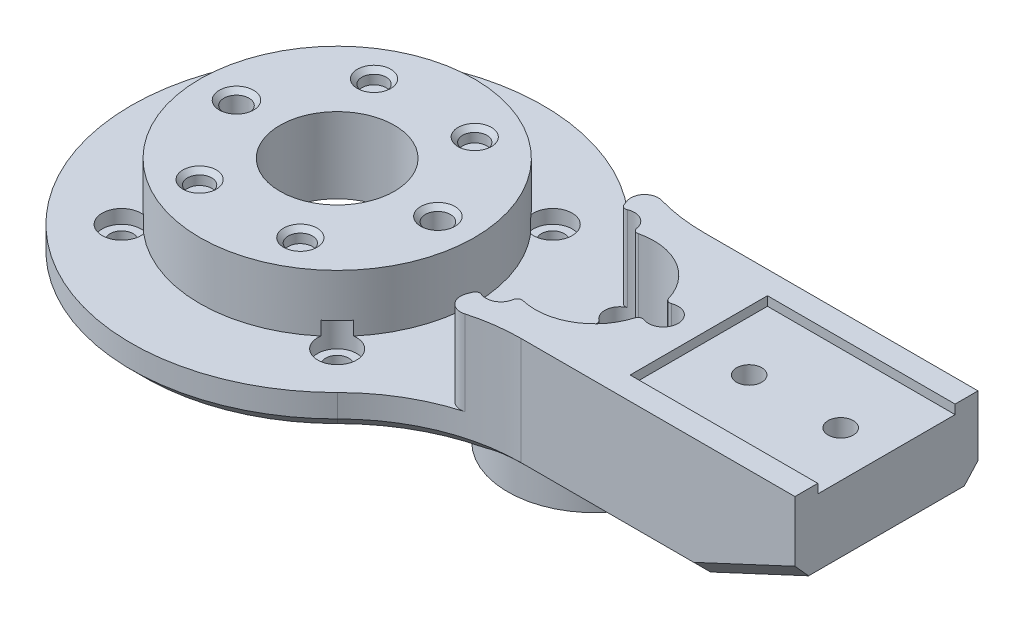
from build123d import *

# Parameters (mm, degrees)
SKETCH1_R           = 30
BOSS_EXTRUDE1_DEPTH = 12.5
SKETCH3_R           = 45.00000000000001
BOSS_EXTRUDE3_DEPTH = 8
CUT_EXTRUDE1_DEPTH  = 2
SKETCH5_R           = 19.5
CUT_EXTRUDE2_DEPTH  = 2
SKETCH6_R           = 2.4999999999999982
CUT_EXTRUDE3_DEPTH  = 67.27405223765936
SKETCH8_R           = 12.5
CUT_EXTRUDE4_DEPTH  = 67.8599282081577
SKETCH12_R          = 4.249999999999998
CUT_EXTRUDE7_DEPTH  = 3
SKETCH9_R           = 2.649999999999998
SKETCH9_R_2         = 2.65
CUT_EXTRUDE11_DEPTH = 3
BOSS_EXTRUDE4_START = -8
BOSS_EXTRUDE4_DEPTH = 8
BOSS_EXTRUDE5_DEPTH = 18.5
CHAMFER1_SIZE       = 10
CHAMFER1_SIZE2      = 21.445069205095713
FILLET1_R           = 40
SKETCH21_R          = 13.000000000000023
CUT_EXTRUDE12_DEPTH = 65.99999999999999
SKETCH22_R          = 19.00000000000001
BOSS_EXTRUDE6_DEPTH = 5
CUT_EXTRUDE13_START = 22.000000000000007
SKETCH24_R          = 13.000000000000023
CUT_EXTRUDE13_DEPTH = 22.000000000000007
CUT_EXTRUDE14_DEPTH = 41
SKETCH26_R          = 2.750000000000008
CUT_EXTRUDE15_DEPTH = 131.87111980876452
SKETCH27_R          = 4.600000000000013
SKETCH27_R_2        = 4.599999999999999
CUT_EXTRUDE16_DEPTH = 12
CHAMFER3_SIZE       = 3
SKETCH43_R          = 1.749999999999997
SKETCH43_R_2        = 1.7500000000000038
SKETCH43_R_3        = 1.7500000000000033
CUT_EXTRUDE22_DEPTH = 42.00000000000001
SKETCH44_R          = 3.0000000000000013
CUT_EXTRUDE23_DEPTH = 7.99999999999998
SKETCH17_R          = 2.7499999999999982
CUT_EXTRUDE25_DEPTH = 131.67230004863384
CUT_EXTRUDE26_DEPTH = 11.999999999999996
CUT_EXTRUDE27_START = 3
SKETCH48_R          = 4.249999999999998
CUT_EXTRUDE27_DEPTH = 3
FILLET2_R           = 3
SKETCH49_R          = 3.250000000000001
SKETCH49_R_2        = 3.250000000000007
CUT_EXTRUDE28_DEPTH = 23.000000000000007
FILLET3_R           = 1
FILLET4_R           = 1
CHAMFER4_SIZE       = 1
CHAMFER5_SIZE       = 1
CHAMFER6_SIZE       = 1


with BuildPart() as part:
    # Sketch1 → Boss-Extrude1 (new body)
    with BuildSketch(Plane(origin=(0, 0, 0), x_dir=(1, 0, 0), z_dir=(0, 1, 0))):
        with Locations(Location((0, 0, 0), (0, 0, 270))):
            Circle(SKETCH1_R)
    extrude(amount=BOSS_EXTRUDE1_DEPTH)

    # Sketch3 → Boss-Extrude3 (add)
    with BuildSketch(Plane.XZ):
        with Locations(Location((0, 0, 0), (0, 0, 270))):
            Circle(SKETCH3_R)
    extrude(amount=BOSS_EXTRUDE3_DEPTH)

    # Sketch4 → Cut-Extrude1 (cut)
    with BuildSketch(Plane.XZ.offset(8)):
        with BuildLine():
            Line((-23.499999999999993, -28.5), (23.5, -28.5))
            ThreePointArc((23.5, -28.5), (27.035533905932738, -27.035533905932738), (28.499999999999996, -23.5))
            Line((28.499999999999996, -23.5), (28.499999999999996, 23.5))
            ThreePointArc((28.499999999999996, 23.5), (27.035533905932738, 27.03553390593273), (23.500000000000004, 28.499999999999996))
            Line((23.500000000000004, 28.499999999999996), (-23.499999999999996, 28.499999999999996))
            ThreePointArc((-23.499999999999996, 28.499999999999996), (-27.03553390593273, 27.035533905932734), (-28.499999999999996, 23.5))
            Line((-28.499999999999996, 23.5), (-28.49999999999999, -23.5))
            ThreePointArc((-28.49999999999999, -23.5), (-27.03553390593273, -27.035533905932734), (-23.499999999999993, -28.5))
        make_face()
    extrude(amount=-CUT_EXTRUDE1_DEPTH, mode=Mode.SUBTRACT)

    # Sketch5 → Cut-Extrude2 (cut)
    with BuildSketch(Plane.XZ.offset(6)):
        with Locations(Location((0, 0, 0), (0, 0, 270))):
            Circle(SKETCH5_R)
    extrude(amount=-CUT_EXTRUDE2_DEPTH, mode=Mode.SUBTRACT)

    # Sketch6 → Cut-Extrude3 (cut, through all)
    with BuildSketch(Plane.XZ.offset(6)):
        with Locations(Location((-23.550000000000008, 23.549999999999994, 0), (0, 0, 270))):
            Circle(SKETCH6_R)
        with Locations(Location((23.549999999999994, 23.549999999999994, 0), (0, 0, 270))):
            Circle(SKETCH6_R)
        with Locations(Location((23.549999999999994, -23.550000000000008, 0), (0, 0, 270))):
            Circle(SKETCH6_R)
        with Locations(Location((-23.550000000000008, -23.550000000000008, 0), (0, 0, 270))):
            Circle(SKETCH6_R)
    extrude(amount=-CUT_EXTRUDE3_DEPTH, mode=Mode.SUBTRACT)

    # Sketch8 → Cut-Extrude4 (cut, through all)
    with BuildSketch(Plane(origin=(0, 12.5, 0), x_dir=(1, 0, 0), z_dir=(0, 1, 0))):
        with Locations(Location((0, 0, 0), (0, 0, 270))):
            Circle(SKETCH8_R)
    extrude(amount=-CUT_EXTRUDE4_DEPTH, mode=Mode.SUBTRACT)

    # Sketch12 → Cut-Extrude7 (cut)
    with BuildSketch(Plane(origin=(0, 0, 0), x_dir=(1, 0, 0), z_dir=(0, 1, 0))):
        with Locations(Location((-23.550000000000008, 23.550000000000008, 0), (0, 0, 270))):
            Circle(SKETCH12_R)
        with Locations(Location((23.549999999999994, 23.550000000000008, 0), (0, 0, 270))):
            Circle(SKETCH12_R)
        with Locations(Location((23.549999999999994, -23.549999999999994, 0), (0, 0, 270))):
            Circle(SKETCH12_R)
        with Locations(Location((-23.550000000000008, -23.549999999999994, 0), (0, 0, 270))):
            Circle(SKETCH12_R)
    extrude(amount=-CUT_EXTRUDE7_DEPTH, mode=Mode.SUBTRACT)

    # Sketch9 → Cut-Extrude11 (cut)
    with BuildSketch(Plane(origin=(0, 12.5, 0), x_dir=(1, 0, 0), z_dir=(0, 1, 0))):
        with Locations(Location((11.000000000000009, -19.052558883257646, 0), (0, 0, 270))):
            Circle(SKETCH9_R)
        with Locations(Location((10.999999999999996, 19.052558883257657, 0), (0, 0, 270))):
            Circle(SKETCH9_R_2)
        with Locations(Location((-11.000000000000009, 19.05255888325765, 0), (0, 0, 270))):
            Circle(SKETCH9_R)
        with Locations(Location((-10.999999999999984, -19.05255888325766, 0), (0, 0, 270))):
            Circle(SKETCH9_R)
    extrude(amount=-CUT_EXTRUDE11_DEPTH, mode=Mode.SUBTRACT)

    # Sketch19 → Boss-Extrude4 (add)
    with BuildSketch(Plane.XZ.offset(8).offset(BOSS_EXTRUDE4_START)):
        with BuildLine():
            Line((40.31128874149275, -20), (120, -20))
            Line((120, -20), (120, 20))
            Line((120, 20), (40.31128874149275, 20))
            ThreePointArc((40.31128874149275, 20), (45.00000000000001, 0), (40.31128874149275, -20))
        make_face()
    extrude(amount=BOSS_EXTRUDE4_DEPTH)

    # Sketch20 → Boss-Extrude5 (add)
    with BuildSketch(Plane(origin=(0, 0, 0), x_dir=(1, 0, 0), z_dir=(0, 1, 0))):
        with BuildLine():
            Line((44.73253849269008, -20), (120, -20))
            Line((120, -20), (120, 20))
            Line((120, 20), (44.73253849269008, 20))
            ThreePointArc((44.73253849269008, 20), (49, 0), (44.73253849269008, -20))
        make_face()
    extrude(amount=BOSS_EXTRUDE5_DEPTH)

    # Chamfer1
    chamfer1_edges = [part.edges().sort_by_distance(p)[0] for p in [
        (120, -8, 0),
    ]]
    chamfer1_side = [part.faces().sort_by_distance(p)[0] for p in [
        (120, 5.249999999999999, -3e-17),
    ]]
    chamfer(chamfer1_edges, length=CHAMFER1_SIZE, length2=CHAMFER1_SIZE2, reference=chamfer1_side[0])

    # Fillet1
    # the kernel refuses this fillet: 40 mm, written as the material it adds along each edge
    with BuildSketch(Plane(origin=(40.31128874149275, 49.74171038117195, -20), x_dir=(1, 0, 0), z_dir=(0, -1, 0))) as fillet1_piece_1_section:
        with BuildLine():
            CenterArc((19.896684152468794, -40), FILLET1_R, 90, 45.09912784402732)
            ThreePointArc((-8.436479562336622, -11.764705882352953), (-3.7420358180743776, -6.223839166358861), (0, 0))
            Line((0, 0), (19.896684152468794, 0))
        make_face()
    fillet1_piece_1 = extrude(amount=57.74171038117195, mode=Mode.PRIVATE)
    fillet1_piece_1 = split(fillet1_piece_1, bisect_by=Plane(origin=(49.71074932884611, 0, -20.545678169100498), z_dir=(0, 1, 0)), keep=Keep.TOP, mode=Mode.PRIVATE)
    fillet1_piece_1 = split(fillet1_piece_1, bisect_by=Plane(origin=(49.71074932884611, 18.5, -20.545678169100498), z_dir=(0, -1, 0)), keep=Keep.TOP, mode=Mode.PRIVATE)
    fillet1_piece_1 = fillet1_piece_1 - Plane(origin=(1.066e-14, 9.250000000000002, 0), x_dir=(0.9129089488304098, 0, -0.40816326530612257), z_dir=(0, -1, 0)) * Cylinder(48.99999999999998, 196, mode=Mode.PRIVATE)
    add(fillet1_piece_1)
    with BuildSketch(Plane(origin=(40.31128874149275, 0, -19.999999999999996), x_dir=(1, 0, -1.8e-16), z_dir=(0, -1, 0))) as fillet1_piece_2_section:
        with BuildLine():
            CenterArc((19.896684152468787, -40), FILLET1_R, 90.00000000000001, 45.09912784402731)
            ThreePointArc((-8.436479562336634, -11.764705882352958), (-3.7420358180743762, -6.223839166358865), (0, 0))
            Line((0, 0), (19.89668415246878, 0))
        make_face()
    fillet1_piece_2 = extrude(amount=8, mode=Mode.PRIVATE)
    fillet1_piece_2 = fillet1_piece_2 - Plane(origin=(1.066e-14, -4, 0), x_dir=(0.9129089488304098, 0, -0.40816326530612257), z_dir=(0, -1, 0)) * Cylinder(48.99999999999998, 96, mode=Mode.PRIVATE)
    add(fillet1_piece_2)
    with BuildSketch(Plane(origin=(40.31128874149275, 0, -19.999999999999996), x_dir=(1, 0, -1.8e-16), z_dir=(0, -1, 0))) as fillet1_piece_3_section:
        with BuildLine():
            CenterArc((19.896684152468787, -40), FILLET1_R, 90.00000000000001, 45.09912784402731)
            ThreePointArc((-8.436479562336634, -11.764705882352958), (-3.7420358180743762, -6.223839166358865), (0, 0))
            Line((0, 0), (19.89668415246878, 0))
        make_face()
    fillet1_piece_3 = extrude(amount=8, mode=Mode.PRIVATE)
    fillet1_piece_3 = fillet1_piece_3 & Plane(origin=(1.066e-14, -4, 0), x_dir=(0.9129089488304098, 0, -0.40816326530612257), z_dir=(0, -1, 0)) * Cylinder(48.99999999999998, 96, mode=Mode.PRIVATE)
    add(fillet1_piece_3)
    with BuildSketch(Plane(origin=(40.31128874149277, 49.741710381172, 19.999999999999993), x_dir=(-0.5827519814746416, 0, 0.8126500649648526), z_dir=(0, -1, 0))) as fillet1_piece_4_section:
        with BuildLine():
            CenterArc((20.911170483967823, -39.479120928074536), FILLET1_R, 99.25653609736482, 45.09912784402739)
            Line((-11.594832114626303, -16.1690416690889), (0, 0))
            ThreePointArc((0, 0), (7.238482090604254, -0.5859889559161554), (14.476964181208507, 5.7e-16))
        make_face()
    fillet1_piece_4 = extrude(amount=57.741710381172, mode=Mode.PRIVATE)
    fillet1_piece_4 = split(fillet1_piece_4, bisect_by=Plane(origin=(49.710749328846134, 0, 20.545678169100455), z_dir=(0, 1, 0)), keep=Keep.TOP, mode=Mode.PRIVATE)
    fillet1_piece_4 = split(fillet1_piece_4, bisect_by=Plane(origin=(49.710749328846134, 18.5, 20.545678169100455), z_dir=(0, -1, 0)), keep=Keep.TOP, mode=Mode.PRIVATE)
    fillet1_piece_4 = fillet1_piece_4 - Plane(origin=(1.066e-14, 9.25, 0), x_dir=(0.9129089488304098, 0, -0.40816326530612257), z_dir=(0, -1, 0)) * Cylinder(48.99999999999998, 181, mode=Mode.PRIVATE)
    add(fillet1_piece_4)
    with BuildSketch(Plane(origin=(40.31128874149275, 0, 20), x_dir=(-0.5827519814746411, 0, 0.8126500649648528), z_dir=(0, -1, 0))) as fillet1_piece_5_section:
        with BuildLine():
            CenterArc((20.911170483967826, -39.47912092807453), FILLET1_R, 99.25653609736484, 45.09912784402739)
            Line((-11.594832114626307, -16.169041669088912), (0, 0))
            ThreePointArc((0, 0), (7.23848209060424, -0.5859889559161596), (14.476964181208492, 1.7e-16))
        make_face()
    fillet1_piece_5 = extrude(amount=8, mode=Mode.PRIVATE)
    fillet1_piece_5 = fillet1_piece_5 & Plane(origin=(1.066e-14, -4, 0), x_dir=(0.9129089488304098, 0, -0.40816326530612257), z_dir=(0, -1, 0)) * Cylinder(48.99999999999998, 81, mode=Mode.PRIVATE)
    add(fillet1_piece_5)
    with BuildSketch(Plane(origin=(40.31128874149275, 0, 20), x_dir=(-0.5827519814746411, 0, 0.8126500649648528), z_dir=(0, -1, 0))) as fillet1_piece_6_section:
        with BuildLine():
            CenterArc((20.911170483967826, -39.47912092807453), FILLET1_R, 99.25653609736484, 45.09912784402739)
            Line((-11.594832114626307, -16.169041669088912), (0, 0))
            ThreePointArc((0, 0), (7.23848209060424, -0.5859889559161596), (14.476964181208492, 1.7e-16))
        make_face()
    fillet1_piece_6 = extrude(amount=8, mode=Mode.PRIVATE)
    fillet1_piece_6 = fillet1_piece_6 - Plane(origin=(1.066e-14, -4, 0), x_dir=(0.9129089488304098, 0, -0.40816326530612257), z_dir=(0, -1, 0)) * Cylinder(48.99999999999998, 81, mode=Mode.PRIVATE)
    add(fillet1_piece_6)

    # Sketch21 → Cut-Extrude12 (cut)
    with BuildSketch(Plane.XZ.offset(8)):
        with Locations(Location((56.250000000000114, -6.58e-15, 0), (0, 0, 270))):
            Circle(SKETCH21_R)
    extrude(amount=-CUT_EXTRUDE12_DEPTH, mode=Mode.SUBTRACT)

    # Sketch22 → Boss-Extrude6 (add)
    with BuildSketch(Plane.XZ.offset(8)):
        with Locations(Location((56.250000000000114, -6.58e-15, 0), (0, 0, 270))):
            Circle(SKETCH22_R)
    extrude(amount=BOSS_EXTRUDE6_DEPTH)

    # Sketch24 → Cut-Extrude13 (cut)
    with BuildSketch(Plane.XZ.offset(8).offset(CUT_EXTRUDE13_START)):
        with Locations(Location((56.250000000000114, -6.58e-15, 0), (0, 0, 270))):
            Circle(SKETCH24_R)
    extrude(amount=-CUT_EXTRUDE13_DEPTH, mode=Mode.SUBTRACT)

    # Sketch25 → Cut-Extrude14 (cut)
    with BuildSketch(Plane(origin=(120, 0, 0), x_dir=(0, 0, -1), z_dir=(1, 0, 0))):
        Polygon((15.000000000000014, 20.500000000000007), (-14.999999999999986, 20.5), (-14.999999999999986, 16.5), (15.000000000000014, 16.500000000000004), align=None)
    extrude(amount=-CUT_EXTRUDE14_DEPTH, mode=Mode.SUBTRACT)

    # Sketch26 → Cut-Extrude15 (cut, through all)
    with BuildSketch(Plane.XZ.offset(8)):
        with Locations(Location((110, -2.45e-15, 0), (0, 0, 270))):
            Circle(SKETCH26_R)
        with Locations(Location((90, -4.9e-15, 0), (0, 0, 270))):
            Circle(SKETCH26_R)
    extrude(amount=-CUT_EXTRUDE15_DEPTH, mode=Mode.SUBTRACT)

    # Sketch27 → Cut-Extrude16 (cut)
    with BuildSketch(Plane.XZ.offset(8)):
        with Locations(Location((90, -4.9e-15, 0), (0, 0, 270))):
            Circle(SKETCH27_R)
        with Locations(Location((110, -2.45e-15, 0), (0, 0, 270))):
            Circle(SKETCH27_R_2)
    extrude(amount=-CUT_EXTRUDE16_DEPTH, mode=Mode.SUBTRACT)

    # Chamfer3
    # the kernel refuses this chamfer: 3 mm, written as the material it takes off along each edge
    with BuildSketch(Plane(origin=(106.26997975880202, -8, 20), x_dir=(0, 0.9996219169112968, 0.027495876610586775), z_dir=(-1, 0, 0))) as chamfer3_piece_1_section:
        Polygon((CHAMFER3_SIZE * 0.999621916911, CHAMFER3_SIZE * 0.0274958766106), (-CHAMFER3_SIZE * 0.0274958766106, CHAMFER3_SIZE * 0.999621916911), (0, 0), align=None)
    chamfer3_piece_1 = extrude(amount=46.062006864840214, mode=Mode.PRIVATE)
    chamfer3_piece_1 = chamfer3_piece_1 - Plane(origin=(56.250000000000114, -7.002647008936548, -6.58e-15), x_dir=(-1.8e-16, 0, -1), z_dir=(0, 1, 0)) * Cylinder(19.00000000000001, 105, mode=Mode.PRIVATE)
    add(chamfer3_piece_1, mode=Mode.SUBTRACT)
    with BuildSketch(Plane(origin=(126.99220895334958, 5.260520582366828, 20), x_dir=(-0.4224584769229561, 0.9059651273892122, 0.02749587661058674), z_dir=(-0.9063077870366509, -0.4226182617406975, 0))) as chamfer3_piece_2:
        Polygon((CHAMFER3_SIZE * 0.999621916911, CHAMFER3_SIZE * 0.0274958766106), (-CHAMFER3_SIZE * 0.0274958766106, CHAMFER3_SIZE * 0.999621916911), (0, 0), align=None)
    extrude(amount=39.09211375932059, mode=Mode.SUBTRACT)
    with BuildSketch(Plane(origin=(126.9922089533496, 5.260520582366844, -20), x_dir=(0.011620259578202292, -0.02491972708357244, 0.9996219169112968), z_dir=(-0.9063077870366509, -0.4226182617406975, 0))) as chamfer3_piece_3:
        Polygon((CHAMFER3_SIZE * 0.999621916911, CHAMFER3_SIZE * 0.0274958766106), (-CHAMFER3_SIZE * 0.0274958766106, CHAMFER3_SIZE * 0.999621916911), (0, 0), align=None)
    extrude(amount=39.09211375932061, mode=Mode.SUBTRACT)
    with BuildSketch(Plane(origin=(0, -8, 0), x_dir=(0.7083290928701389, 0, -0.7058823529411726), z_dir=(0.7058823529411726, 0, 0.7083290928701389))) as chamfer3_piece_4:
        Polygon((45.00000000000001, CHAMFER3_SIZE), (45.000000000000014 - CHAMFER3_SIZE, 0), (45.000000000000014, 0), align=None)
    revolve(axis=Axis((0, -8, 0), (0, 1, 0)), revolution_arc=270.19825568805487, mode=Mode.SUBTRACT)
    with BuildSketch(Plane(origin=(60.207972893962, -8, -20), x_dir=(0, -0.027495876610586254, 0.9996219169112968), z_dir=(1, 0, 0))) as chamfer3_piece_5_section:
        Polygon((CHAMFER3_SIZE * 0.999621916911, -CHAMFER3_SIZE * 0.0274958766106), (-CHAMFER3_SIZE * 0.0274958766106, -CHAMFER3_SIZE * 0.999621916911), (0, 0), align=None)
    chamfer3_piece_5 = extrude(amount=46.062006864840036, mode=Mode.PRIVATE)
    chamfer3_piece_5 = chamfer3_piece_5 - Plane(origin=(56.250000000000114, -7.002647009133689, -6.58e-15), x_dir=(-1.8e-16, 0, -1), z_dir=(0, 1, 0)) * Cylinder(19.00000000000001, 105, mode=Mode.PRIVATE)
    add(chamfer3_piece_5, mode=Mode.SUBTRACT)
    with BuildSketch(Plane(origin=(60.207972893962, -8, -60), x_dir=(0, 0, 1), z_dir=(1, 0, 0))) as chamfer3_piece_6_section:
        Polygon((40 + CHAMFER3_SIZE, 0), (40, -CHAMFER3_SIZE), (40, 0), align=None)
    chamfer3_piece_6 = revolve(axis=Axis((60.207972893962, -8, -60), (0, -1, 0)), revolution_arc=45.09912784402748, mode=Mode.PRIVATE)
    chamfer3_piece_6 = chamfer3_piece_6 - Plane(origin=(56.250000000000114, -6.97770781907012, -6.58e-15), x_dir=(-1.8e-16, 0, -1), z_dir=(0, 1, 0)) * Cylinder(19.00000000000001, 172, mode=Mode.PRIVATE)
    add(chamfer3_piece_6, mode=Mode.SUBTRACT)
    with BuildSketch(Plane(origin=(60.20797289395381, -8, 60.00000000000448), x_dir=(-0.7083290928699841, 0, -0.705882352941328), z_dir=(-0.705882352941328, 0, 0.7083290928699841))) as chamfer3_piece_7_section:
        Polygon((40.00000000000001, -CHAMFER3_SIZE), (40.00000000000001 + CHAMFER3_SIZE, 0), (40.00000000000001, 0), align=None)
    chamfer3_piece_7 = revolve(axis=Axis((60.20797289395381, -8, 60.00000000000448), (0, -1, 0)), revolution_arc=45.099127844026505, mode=Mode.PRIVATE)
    chamfer3_piece_7 = chamfer3_piece_7 - Plane(origin=(56.250000000000114, -6.977707901819728, -6.58e-15), x_dir=(-1.8e-16, 0, -1), z_dir=(0, 1, 0)) * Cylinder(19.00000000000001, 173, mode=Mode.PRIVATE)
    add(chamfer3_piece_7, mode=Mode.SUBTRACT)

    # Sketch43 → Cut-Extrude22 (cut)
    with BuildSketch(Plane.XZ.offset(13.000000000000002)):
        with Locations(Location((71.24999977997406, -0.00256918834106584, 0), (0, 0, 270))):
            Circle(SKETCH43_R)
        with Locations(Location((48.748016996721084, -12.989235967463996, 0), (0, 0, 270))):
            Circle(SKETCH43_R_2)
        with Locations(Location((48.75222509238402, 12.991665460389207, 0), (0, 0, 270))):
            Circle(SKETCH43_R_3)
    extrude(amount=-CUT_EXTRUDE22_DEPTH, mode=Mode.SUBTRACT)

    # Sketch44 → Cut-Extrude23 (cut)
    with BuildSketch(Plane(origin=(0, 0, 0), x_dir=(1, 0, 0), z_dir=(0, 1, 0))):
        with Locations((48.75222509238402, -12.991665460389207)):
            Circle(SKETCH44_R)
    extrude(amount=-CUT_EXTRUDE23_DEPTH, mode=Mode.SUBTRACT)

    # Sketch17 → Cut-Extrude25 (cut, through all)
    with BuildSketch(Plane(origin=(0, 12.5, 0), x_dir=(1, 0, 0), z_dir=(0, 1, 0))):
        with Locations(Location((22, 2.69e-15, 0), (0, 0, 270))):
            Circle(SKETCH17_R)
        with Locations(Location((-22, 0, 0), (0, 0, 270))):
            Circle(SKETCH17_R)
    extrude(amount=-CUT_EXTRUDE25_DEPTH, mode=Mode.SUBTRACT)

    # Sketch47 → Cut-Extrude26 (cut)
    with BuildSketch(Plane.XZ.offset(6)):
        Polygon((-26.24999999999975, 2.453738644056333), (-26.250000000000238, -2.453738644055488), (-22.000000000000494, -4.907477288111818), (-17.750000000000238, -2.453738644056329), (-17.749999999999748, 2.4537386440554845), (-21.99999999999951, 4.90747728811182), align=None)
        Polygon((17.75, 2.4537386440559055), (17.75, -2.4537386440559144), (22, -4.907477288111824), (26.25, -2.453738644055911), (26.25, 2.4537386440559064), (22, 4.907477288111816), align=None)
    extrude(amount=-CUT_EXTRUDE26_DEPTH, mode=Mode.SUBTRACT)

    # Sketch48 → Cut-Extrude27 (cut)
    with BuildSketch(Plane(origin=(0, 0, 0), x_dir=(1, 0, 0), z_dir=(0, 1, 0)).offset(CUT_EXTRUDE27_START)):
        with Locations(Location((23.549999999999994, -23.549999999999994, 0), (0, 0, 270))):
            Circle(SKETCH48_R)
        with Locations(Location((-23.550000000000008, 23.550000000000008, 0), (0, 0, 270))):
            Circle(SKETCH48_R)
        with Locations(Location((23.549999999999994, 23.550000000000008, 0), (0, 0, 270))):
            Circle(SKETCH48_R)
        with BuildLine():
            ThreePointArc((-19.345584274137853, -22.92920341163711), (-20.54479617995718, -20.544796179957167), (-22.929203411637122, -19.345584274137824))
            ThreePointArc((-22.929203411637122, -19.345584274137824), (-26.555203820042845, -26.555203820042827), (-19.345584274137853, -22.92920341163711))
        make_face()
    extrude(amount=-CUT_EXTRUDE27_DEPTH, mode=Mode.SUBTRACT)

    # Fillet2
    fillet2_edges = [part.edges().sort_by_distance(p)[0] for p in [
        (42.7003526621072, 9.25, -24.03497207262104),
        (42.70035266210683, 9.25, 24.034972072621695),
    ]]
    fillet(fillet2_edges, radius=FILLET2_R)

    # Sketch49 → Cut-Extrude28 (cut)
    with BuildSketch(Plane(origin=(0, 18.5, 0), x_dir=(1, 0, 0), z_dir=(0, 1, 0))):
        with Locations((48.748016996721084, 12.989235967463996)):
            Circle(SKETCH49_R)
        with Locations((71.24999977997406, 0.00256918834106584)):
            Circle(SKETCH49_R_2)
        with Locations((48.75222509238402, -12.991665460389207)):
            Circle(SKETCH49_R)
    extrude(amount=-CUT_EXTRUDE28_DEPTH, mode=Mode.SUBTRACT)

    # Fillet3
    fillet3_edges = [part.edges().sort_by_distance(p)[0] for p in [
        (51.91413630414116, 6.9999999999999964, -12.255622628448263),
        (47.801234327769805, -2.2500000000000036, -9.880200332773798),
        (46.52905252337629, 9.25, -15.363829967716079),
        (51.918106588733366, 6.9999999999999964, 12.25702653474423),
        (46.52943318651076, 9.25, 15.362677089037293),
        (47.80443533953652, -2.2500000000000036, 9.882936687337873),
    ]]
    fillet(fillet3_edges, radius=FILLET3_R)

    # Fillet4
    fillet4_edges = [part.edges().sort_by_distance(p)[0] for p in [
        (69.03165656545966, 6.9999999999999964, 2.372605201597058),
        (69.03084305958203, 6.9999999999999964, -2.376983526728293),
    ]]
    fillet(fillet4_edges, radius=FILLET4_R)

    # Chamfer4
    chamfer4_edges = [part.edges().sort_by_distance(p)[0] for p in [
        (22.000000000000004, 12.5, -2.750000000000001),
        (-21.999999999999996, 12.5, -2.7499999999999982),
    ]]
    chamfer(chamfer4_edges, length=CHAMFER4_SIZE)

    # Chamfer5
    chamfer5_edges = [part.edges().sort_by_distance(p)[0] for p in [
        (-11.000000000000009, 12.5, -21.702558883257648),
        (10.999999999999998, 12.5, -21.702558883257655),
        (11.000000000000009, 12.5, 16.402558883257647),
        (-10.999999999999984, 12.5, 16.40255888325766),
    ]]
    chamfer(chamfer5_edges, length=CHAMFER5_SIZE)

    # Chamfer6
    # the kernel refuses this chamfer: 1 mm, written as the material it takes off along each edge
    with BuildSketch(Plane(origin=(48.75222509238402, -7.99999999999998, 12.991665460389207), x_dir=(0, 0, -1), z_dir=(-1, 0, 0))) as chamfer6_piece_1:
        Polygon((1.7500000000000036 + CHAMFER6_SIZE, 0), (1.7500000000000036, CHAMFER6_SIZE), (1.7500000000000036, 0), align=None)
    revolve(axis=Axis((48.75222509238402, -7.99999999999998, 12.991665460389207), (0, -1, 0)), mode=Mode.SUBTRACT)
    with BuildSketch(Plane(origin=(48.748016996721084, -4.500000000000007, -12.989235967463996), x_dir=(0, 0, -1), z_dir=(-1, 0, 0))) as chamfer6_piece_2:
        Polygon((1.7500000000000036 + CHAMFER6_SIZE, 0), (1.7500000000000036, CHAMFER6_SIZE), (1.7500000000000036, 0), align=None)
    revolve(axis=Axis((48.748016996721084, -4.500000000000007, -12.989235967463996), (0, -1, 0)), mode=Mode.SUBTRACT)
    with BuildSketch(Plane(origin=(71.24999977997406, -4.500000000000007, -0.00256918834106584), x_dir=(0, 0, -1), z_dir=(-1, 0, 0))) as chamfer6_piece_3:
        Polygon((1.749999999999997 + CHAMFER6_SIZE, 0), (1.749999999999997, CHAMFER6_SIZE), (1.749999999999997, 0), align=None)
    revolve(axis=Axis((71.24999977997406, -4.500000000000007, -0.00256918834106584), (0, -1, 0)), mode=Mode.SUBTRACT)


solid = part.part
